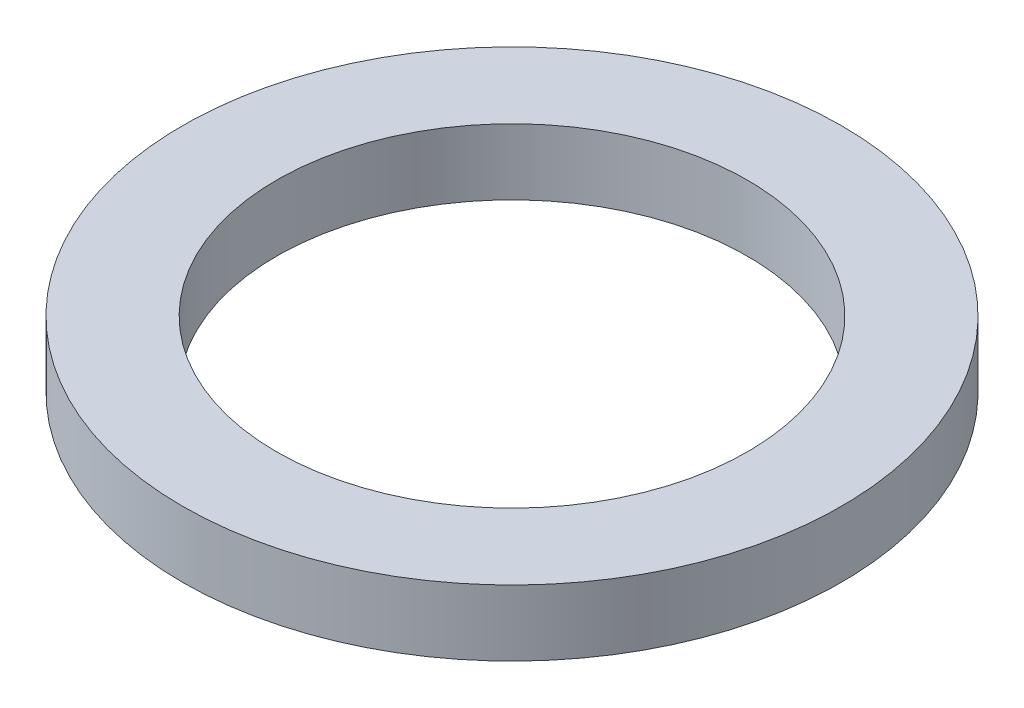
from build123d import *

# Parameters (mm, degrees)
SKETCH1_R           = 70
BOSS_EXTRUDE1_DEPTH = 14
SKETCH2_R           = 50
CUT_EXTRUDE1_DEPTH  = 100.979998


with BuildPart() as part:
    # Sketch1 → Boss-Extrude1 (new body)
    with BuildSketch(Plane(origin=(0, 0, 0), x_dir=(1, 0, 0), z_dir=(0, 1, 0))):
        Circle(SKETCH1_R)
    extrude(amount=BOSS_EXTRUDE1_DEPTH)

    # Sketch2 → Cut-Extrude1 (cut, through all)
    with BuildSketch(Plane(origin=(0, 0, 0), x_dir=(1, 0, 0), z_dir=(0, 1, 0))):
        Circle(SKETCH2_R)
    extrude(amount=CUT_EXTRUDE1_DEPTH, mode=Mode.SUBTRACT)


solid = part.part
